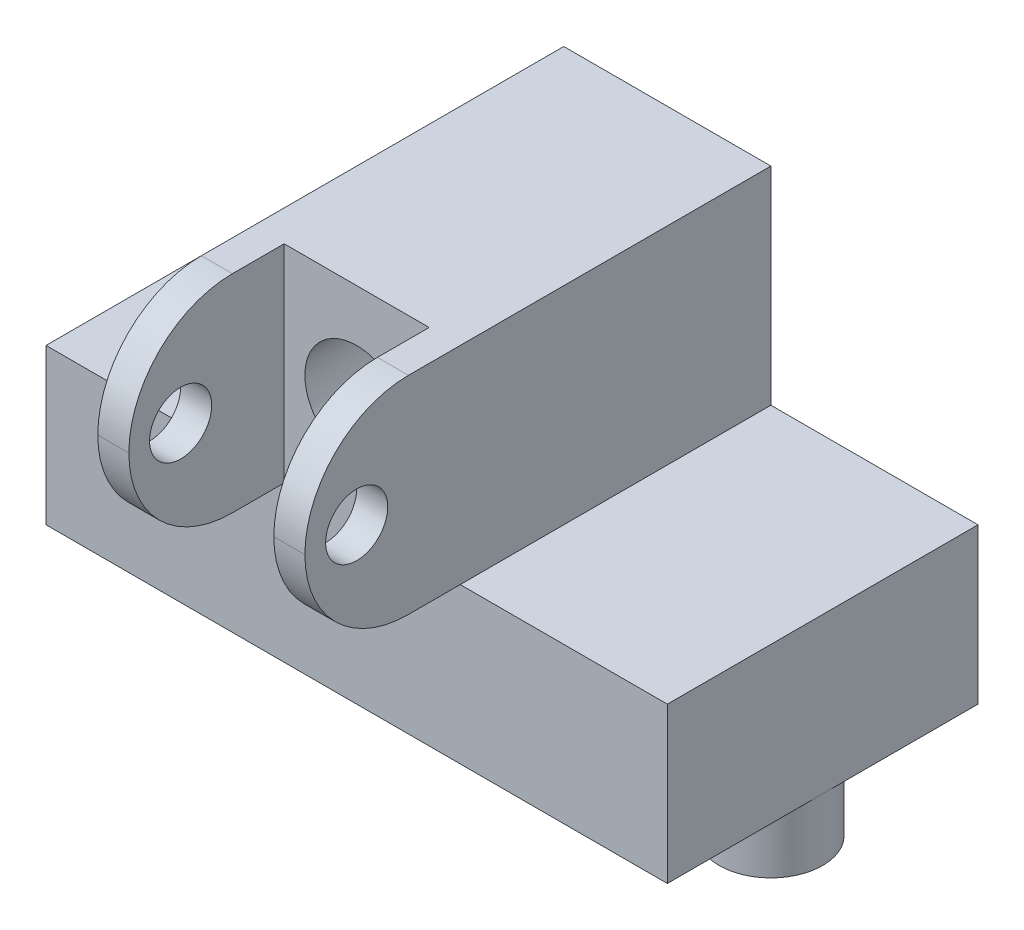
from build123d import *

# Parameters (mm, degrees)
ESQUISSE2_W             = 60
ESQUISSE2_H             = 30
BOSS_EXTRU_1_DEPTH      = 15
ESQUISSE3_R             = 5
BOSS_EXTRU_2_DEPTH      = 6
BOSS_EXTRU_3_DEPTH      = 20
ESQUISSE5_R             = 5
ENL_V_MAT_EXTRU_1_DEPTH = 30
ESQUISSE6_W             = 3
ESQUISSE6_H             = 20
BOSS_EXTRU_4_DEPTH      = 15
CONG_2_R                = 10
CONG_3_R                = 10
CONG_4_R                = 10
CONG_5_R                = 10
ESQUISSE7_R             = 3
ENL_V_MAT_EXTRU_2_DEPTH = 27


with BuildPart() as part:
    # Esquisse2 → Boss.-Extru.1 (new body)
    with BuildSketch(Plane(origin=(0, 0, 0), x_dir=(1, 0, 0), z_dir=(0, 1, 0))):
        with Locations((-5, 0)):
            Rectangle(ESQUISSE2_W, ESQUISSE2_H)
    extrude(amount=BOSS_EXTRU_1_DEPTH)

    # Esquisse3 → Boss.-Extru.2 (add)
    with BuildSketch(Plane.XZ):
        with Locations(Location((-20, 0, 0), (0, 0, 90))):
            Circle(ESQUISSE3_R)
        with Locations(Location((20, 0, 0), (0, 0, 90))):
            Circle(ESQUISSE3_R)
    extrude(amount=BOSS_EXTRU_2_DEPTH)

    # Esquisse4 → Boss.-Extru.3 (add)
    with BuildSketch(Plane(origin=(0, 15, 0), x_dir=(1, 0, 0), z_dir=(0, 1, 0))):
        Polygon((-5, 15), (-15, 15), (-15, -15), (5, -15), (5, 15), align=None)
    extrude(amount=BOSS_EXTRU_3_DEPTH)

    # Esquisse5 → Enlèv. mat.-Extru.1 (cut)
    with BuildSketch(Plane(origin=(0, 0, -15), x_dir=(-1, 0, 0), z_dir=(0, 0, -1))):
        with Locations((5, 25)):
            Circle(ESQUISSE5_R)
    extrude(amount=-ENL_V_MAT_EXTRU_1_DEPTH, mode=Mode.SUBTRACT)

    # Esquisse6 → Boss.-Extru.4 (add)
    with BuildSketch(Plane.XY.offset(15)):
        with Locations((-13.5, 25)):
            Rectangle(ESQUISSE6_W, ESQUISSE6_H)
        with Locations((3.5, 25)):
            Rectangle(ESQUISSE6_W, ESQUISSE6_H)
    extrude(amount=BOSS_EXTRU_4_DEPTH)

    # Congé2
    cong_2_edges = [part.edges().sort_by_distance(p)[0] for p in [
        (3.5, 35, 30),
    ]]
    fillet(cong_2_edges, radius=CONG_2_R)

    # Congé3
    cong_3_edges = [part.edges().sort_by_distance(p)[0] for p in [
        (3.5, 15, 30),
    ]]
    fillet(cong_3_edges, radius=CONG_3_R - 0.0001)  # a hair under: the kernel refuses the full size

    # Congé4
    cong_4_edges = [part.edges().sort_by_distance(p)[0] for p in [
        (-13.5, 15, 30),
    ]]
    fillet(cong_4_edges, radius=CONG_4_R)

    # Congé5
    cong_5_edges = [part.edges().sort_by_distance(p)[0] for p in [
        (-13.5, 35, 30),
    ]]
    fillet(cong_5_edges, radius=CONG_5_R - 0.0001)  # a hair under: the kernel refuses the full size

    # Esquisse7 → Enlèv. mat.-Extru.2 (cut)
    with BuildSketch(Plane.ZY.offset(15)):
        with Locations((25, 25)):
            Circle(ESQUISSE7_R)
    extrude(amount=-ENL_V_MAT_EXTRU_2_DEPTH, mode=Mode.SUBTRACT)


solid = part.part
